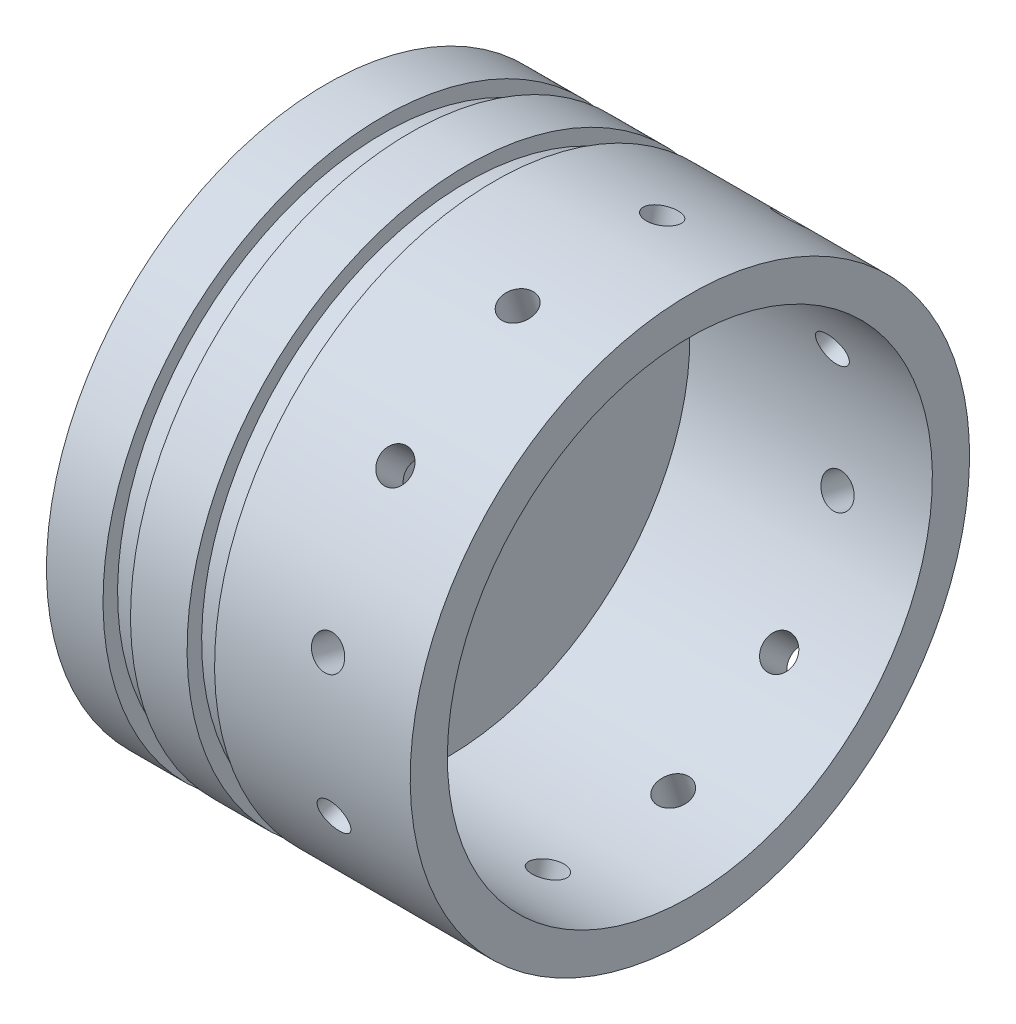
from build123d import *

# Parameters (mm, degrees)
THREAD1_PITCH     = 1.814285714
CIRPATTERN1_COUNT = 12


with BuildPart() as part:
    # Sketch1 → Revolve1 (revolve)
    with BuildSketch(Plane.XY, mode=Mode.PRIVATE) as revolve1_sk:
        Polygon((13.208, 43.942), (22.098, 43.942), (22.098, 41.656), (26.416, 41.656), (26.416, 43.942), (57.15, 43.942), (57.15, 38.1), (19.05, 38.1), (19.05, 5.55625), (0, 5.55625), (0, 43.942), (8.89, 43.942), (8.89, 41.656), (13.208, 41.656), align=None)
    revolve(revolve1_sk.sketch.rotate(Axis((0, 0, 0), (1, 0, 0)), 180), axis=Axis((0, 0, 0), (1, 0, 0)))

    # Thread1: the profile of Thread Profile2 profile screwed along a right-hand helix of 10.5 turns, 10 arcs to a turn; built about Z, then put on its axis
    thread1_z = Axis((0, 0, 0), (0, 0, 1))
    thread1_corners = [(5.55595, 0, -0.000173205), (6.538260945, 0, 0.566964283), (6.538260945, 0, 0.793749998), (5.55595, 0, 1.360887486)]
    with BuildLine(mode=Mode.PRIVATE) as thread1_profile:
        Line(thread1_corners[0], thread1_corners[1])
        Line(thread1_corners[1], thread1_corners[2])
        Line(thread1_corners[2], thread1_corners[3])
        Line(thread1_corners[3], thread1_corners[0])
    thread1_cap = Face(thread1_profile.wire())
    thread1_turn_angles = [0, 18, 36, 54, 72, 90, 108, 126, 144, 162, 180, 198, 216, 234, 252, 270, 288, 306, 324, 342, 360]
    thread1_turn_weights = [1, 0.9510565162951535, 1, 0.9510565162951535, 1, 0.9510565162951535, 1, 0.9510565162951535, 1, 0.9510565162951535, 1, 0.9510565162951535, 1, 0.9510565162951535, 1, 0.9510565162951535, 1, 0.9510565162951535, 1, 0.9510565162951535, 1]
    thread1_turn_rails = [Edge.make_bspline([Vector(p[0], p[1], 0).rotate(thread1_z, thread1_turn_angles[k]) / thread1_turn_weights[k] + Vector(0, 0, p[2] + THREAD1_PITCH * thread1_turn_angles[k] / 360) for k in range(21)], [0, 0, 0, 1, 1, 2, 2, 3, 3, 4, 4, 5, 5, 6, 6, 7, 7, 8, 8, 9, 9, 10, 10, 10], 2, thread1_turn_weights) for p in thread1_corners]
    thread1_turn_sides = [Face.make_surface_from_curves(thread1_turn_rails[p[0]], thread1_turn_rails[p[1]]) for p in [(0, 1), (1, 2), (2, 3), (3, 0)]]
    thread1_last_angles = [3600, 3618, 3636, 3654, 3672, 3690, 3708, 3726, 3744, 3762, 3780]
    thread1_last_weights = [1, 0.9510565162951535, 1, 0.9510565162951535, 1, 0.9510565162951535, 1, 0.9510565162951535, 1, 0.951056516295156, 1]
    thread1_last_rails = [Edge.make_bspline([Vector(p[0], p[1], 0).rotate(thread1_z, thread1_last_angles[k]) / thread1_last_weights[k] + Vector(0, 0, p[2] + THREAD1_PITCH * thread1_last_angles[k] / 360) for k in range(11)], [0, 0, 0, 1, 1, 2, 2, 3, 3, 4, 4, 5, 5, 5], 2, thread1_last_weights) for p in thread1_corners]
    thread1_last_sides = [Face.make_surface_from_curves(thread1_last_rails[p[0]], thread1_last_rails[p[1]]) for p in [(0, 1), (1, 2), (2, 3), (3, 0)]]
    thread1 = Plane(origin=(19.05, 0, 0), x_dir=(0, 0, 1), z_dir=(-1, 0, 0)) * Solid(Shell([*[p.moved(Location((0, 0, THREAD1_PITCH * i))) for i in range(10) for p in thread1_turn_sides], *thread1_last_sides, thread1_cap, thread1_cap.rotate(thread1_z, 3780).moved(Location((0, 0, THREAD1_PITCH * 3780 / 360)))]))
    add(thread1, mode=Mode.SUBTRACT)

    # Sketch2 → 1/4-20 Tapped Hole1 (revolve, cut)
    with BuildSketch(Plane(origin=(43.18, 41.943899234, 13.099949659), x_dir=(0, -0.29811910378753365, 0.9545286794837113), z_dir=(1, 0, 0))):
        Polygon((0, 0), (0, 45.474816902), (2.5527, 43.941), (2.5527, 0), align=None)
    f_1_4_20_tapped_hole1 = revolve(axis=Axis((43.18, 48.005156349, 14.993005968), (0, -0.9545286794837113, -0.29811910378753365)), mode=Mode.SUBTRACT)

    # CirPattern1: 1/4-20 Tapped Hole1 ×12 about axis
    cirpattern1_axis = Axis((57.15, 0, 0), (-1, 0, 0))
    for i in range(1, CIRPATTERN1_COUNT):
        add(f_1_4_20_tapped_hole1.rotate(cirpattern1_axis, i * 360 / CIRPATTERN1_COUNT), mode=Mode.SUBTRACT)


solid = part.part
